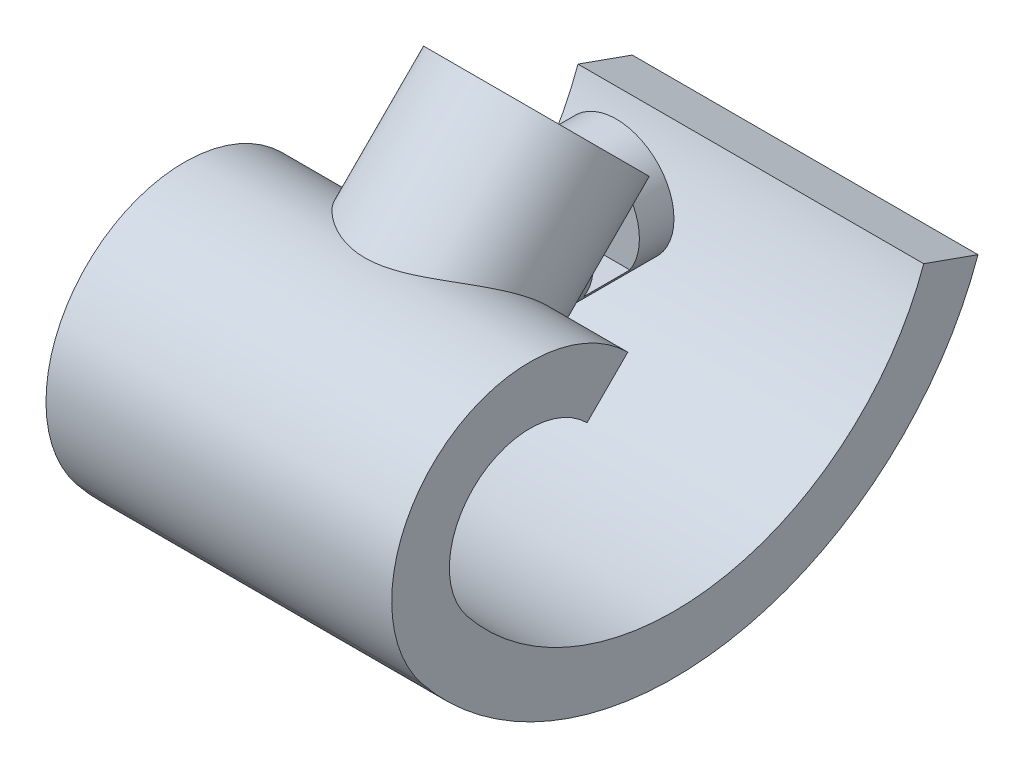
from build123d import *

# Parameters (mm, degrees)
EXTRUDE_THIN1_DEPTH      = 15
BOSS_EXTRUDE1_DEPTH      = 10
BOSS_EXTRUDE1_DEPTH_BACK = 5
SKETCH3_R                = 8
SKETCH3_R_2              = 4
SKETCH5_R                = 5
BOSS_EXTRUDE2_DEPTH      = 10
SKETCH6_R                = 1.5
CUT_EXTRUDE2_DEPTH       = 14
SKETCH4_R                = 4
CUT_EXTRUDE1_DEPTH       = 20
CUT_EXTRUDE3_DEPTH       = 3
CHAMFER1_SIZE            = 1


with BuildPart() as part:
    # Sketch1 → Extrude-Thin1 (new, symmetric)
    with BuildSketch(Plane(origin=(0, 0, 0), x_dir=(0, 0, -1), z_dir=(1, 0, 0))):
        with BuildLine():
            ThreePointArc((-4.004714623, 8.485281374), (-20.494799633, 8.939973084), (-21.857492994, -7.5))
            ThreePointArc((-21.857492994, -7.5), (4.648037658, -17.611514734), (26.382299048, 0.620538558))
            Line((26.382299048, 0.620538558), (21.671174218, 2.295442387))
            ThreePointArc((21.671174218, 2.295442387), (3.818030934, -12.680887103), (-17.954369245, -4.375))
            ThreePointArc((-17.954369245, -4.375), (-17.159464785, 5.214984299), (-7.540248528, 4.949747468))
            Line((-7.540248528, 4.949747468), (-4.004714623, 8.485281374))
        make_face()
    extrude(amount=EXTRUDE_THIN1_DEPTH, both=True)

    # Sketch3 → Boss-Extrude1 (add, two sides: drawn at the far end of the back side and taken through both)
    with BuildSketch(Plane(origin=(0, 2.240283376, -2.240283376), x_dir=(1, 0, 0), z_dir=(0, 0.7071067811865508, -0.7071067811865444)).offset(-BOSS_EXTRUDE1_DEPTH_BACK)):
        with Locations((0, -8.831760866)):
            Circle(SKETCH3_R)
        with Locations((0, -8.831760866)):
            Circle(SKETCH3_R_2, mode=Mode.SUBTRACT)
    extrude(amount=BOSS_EXTRUDE1_DEPTH + BOSS_EXTRUDE1_DEPTH_BACK)

    # Sketch5 → Boss-Extrude2 (add)
    with BuildSketch(Plane.XY):
        with Locations((0, 6.5)):
            Circle(SKETCH5_R)
    extrude(amount=-BOSS_EXTRUDE2_DEPTH)

    # Sketch6 → Cut-Extrude2 (cut)
    with BuildSketch(Plane(origin=(0, 0, -10), x_dir=(-1, 0, 0), z_dir=(0, 0, -1))):
        with Locations((0, 6.5)):
            Circle(SKETCH6_R)
    extrude(amount=-CUT_EXTRUDE2_DEPTH, mode=Mode.SUBTRACT)

    # Sketch4 → Cut-Extrude1 (cut)
    with BuildSketch(Plane(origin=(0, 9.311351188, -9.311351188), x_dir=(1, 0, 0), z_dir=(0, 0.7071067811865507, -0.7071067811865445))):
        with Locations((0, -8.831760866)):
            Circle(SKETCH4_R)
    extrude(amount=-CUT_EXTRUDE1_DEPTH, mode=Mode.SUBTRACT)

    # Sketch7 → Cut-Extrude3 (cut)
    with BuildSketch(Plane(origin=(0, 0, -7), x_dir=(-1, 0, 0), z_dir=(0, 0, -1))):
        Polygon((-18.560605148, 3.75), (1.58771324, 3.75), (3.175426481, 6.5), (1.58771324, 9.25), (-18.560605148, 9.25), align=None)
    extrude(amount=-CUT_EXTRUDE3_DEPTH, mode=Mode.SUBTRACT)

    # Chamfer1
    chamfer1_edges = [part.edges().sort_by_distance(p)[0] for p in [
        (4.789525883, 5.064576084, -4),
    ]]
    chamfer(chamfer1_edges, length=CHAMFER1_SIZE)


solid = part.part
